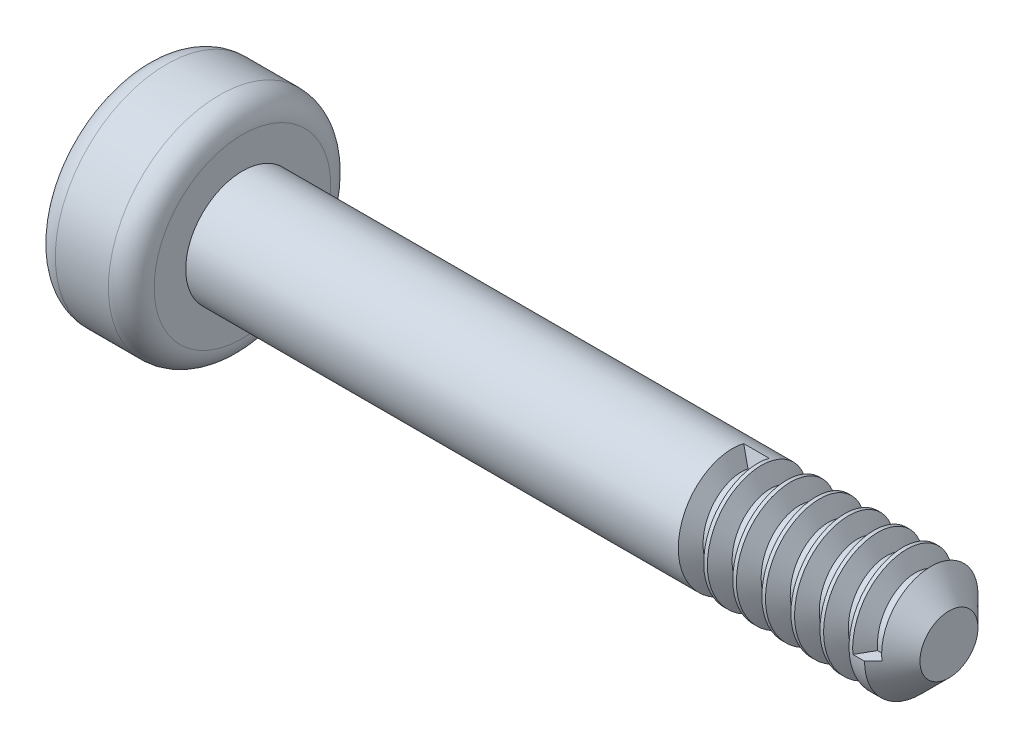
from build123d import *

# Parameters (mm, degrees)
CUT_EXTRUDE1_DEPTH = 0.5
THREAD1_PITCH      = 0.3175


with BuildPart() as part:
    # Sketch2 → Revolve1 (revolve)
    with BuildSketch(Plane.XY, mode=Mode.PRIVATE) as revolve1_sk:
        with BuildLine():
            Line((0, 0), (0, 0.965))
            ThreePointArc((0, 0.965), (0.073223305, 1.141776695), (0.25, 1.215))
            Line((0.25, 1.215), (0.83, 1.215))
            ThreePointArc((0.83, 1.215), (1.006776695, 1.141776695), (1.08, 0.965))
            Line((1.08, 0.965), (1.08, 0.62))
            Line((1.08, 0.62), (1.58, 0.62))
            Line((1.58, 0.62), (5.8, 0.62))
            Line((5.8, 0.62), (8.8, 0.62))
            Line((8.8, 0.62), (8.8, 0))
            Line((8.8, 0), (0, 0))
        make_face()
    revolve(revolve1_sk.sketch.rotate(Axis((0, 0, 0), (-1, 0, 0)), 90), axis=Axis((0, 0, 0), (-1, 0, 0)))

    # Sketch5 → Cut-Extrude1 (cut)
    with BuildSketch(Plane.ZY):
        Polygon((0.2, 0.755), (-0.2, 0.755), (-0.2, 0.2), (-0.755, 0.2), (-0.755, -0.2), (-0.2, -0.2), (-0.2, -0.755), (0.2, -0.755), (0.2, -0.2), (0.755, -0.2), (0.755, 0.2), (0.2, 0.2), align=None)
    extrude(amount=-CUT_EXTRUDE1_DEPTH, mode=Mode.SUBTRACT)

    # Sketch6 → Cut-Revolve1 (revolve, cut)
    with BuildSketch(Plane.XY, mode=Mode.PRIVATE) as cut_revolve1_sk:
        Polygon((8.8, -0.317058243), (8.497058243, -0.62), (8.8, -0.62), align=None)
    revolve(cut_revolve1_sk.sketch.rotate(Axis((-0.208838332, 0, 0), (1, 0, 0)), 90), axis=Axis((-0.208838332, 0, 0), (1, 0, 0)), mode=Mode.SUBTRACT)

    # Thread1: the profile of Thread Profile1 profile screwed along a right-hand helix of 6.299213 turns, 6 arcs to a turn; built about Z, then put on its axis
    thread1_z = Axis((0, 0, 0), (0, 0, 1))
    thread1_corners = [(0.6203, 0, -0.000173205), (0.6203, 0, 0.277985704), (0.448148085, 0, 0.17859375), (0.448148085, 0, 0.09921875)]
    with BuildLine(mode=Mode.PRIVATE) as thread1_profile:
        Line(thread1_corners[0], thread1_corners[1])
        Line(thread1_corners[1], thread1_corners[2])
        Line(thread1_corners[2], thread1_corners[3])
        Line(thread1_corners[3], thread1_corners[0])
    thread1_cap = Face(thread1_profile.wire())
    thread1_turn_angles = [0, 30, 60, 90, 120, 150, 180, 210, 240, 270, 300, 330, 360]
    thread1_turn_weights = [1, 0.8660254037844387, 1, 0.8660254037844387, 1, 0.8660254037844387, 1, 0.8660254037844387, 1, 0.8660254037844387, 1, 0.8660254037844387, 1]
    thread1_turn_rails = [Edge.make_bspline([Vector(p[0], p[1], 0).rotate(thread1_z, thread1_turn_angles[k]) / thread1_turn_weights[k] + Vector(0, 0, p[2] + THREAD1_PITCH * thread1_turn_angles[k] / 360) for k in range(13)], [0, 0, 0, 1, 1, 2, 2, 3, 3, 4, 4, 5, 5, 6, 6, 6], 2, thread1_turn_weights) for p in thread1_corners]
    thread1_turn_sides = [Face.make_surface_from_curves(thread1_turn_rails[p[0]], thread1_turn_rails[p[1]]) for p in [(0, 1), (1, 2), (2, 3), (3, 0)]]
    thread1_last_angles = [2160, 2190, 2220, 2243.858267717, 2267.716535433]
    thread1_last_weights = [1, 0.8660254037844387, 1, 0.9145488039507501, 1]
    thread1_last_rails = [Edge.make_bspline([Vector(p[0], p[1], 0).rotate(thread1_z, thread1_last_angles[k]) / thread1_last_weights[k] + Vector(0, 0, p[2] + THREAD1_PITCH * thread1_last_angles[k] / 360) for k in range(5)], [0, 0, 0, 1, 1, 2, 2, 2], 2, thread1_last_weights) for p in thread1_corners]
    thread1_last_sides = [Face.make_surface_from_curves(thread1_last_rails[p[0]], thread1_last_rails[p[1]]) for p in [(0, 1), (1, 2), (2, 3), (3, 0)]]
    thread1 = Plane(origin=(8.647058243, 0, 0), x_dir=(0, 0, 1), z_dir=(-1, 0, 0)) * Solid(Shell([*[p.moved(Location((0, 0, THREAD1_PITCH * i))) for i in range(6) for p in thread1_turn_sides], *thread1_last_sides, thread1_cap, thread1_cap.rotate(thread1_z, 2267.716535433).moved(Location((0, 0, THREAD1_PITCH * 2267.716535433 / 360)))]))
    add(thread1, mode=Mode.SUBTRACT)


solid = part.part
